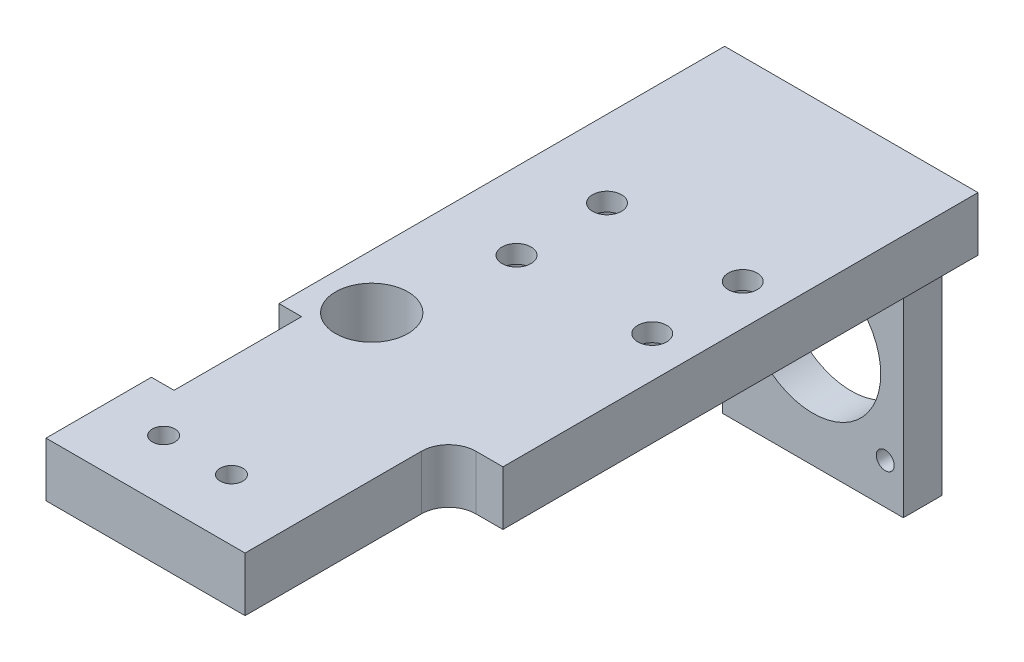
from build123d import *

# Parameters (mm, degrees)
BACK_SKETCH_R                                = 0.8
BACK_SKETCH_R_2                              = 4
BACK_SKETCH_R_3                              = 1.25
BACK_EXTRUDE_DEPTH                           = 6
BOTTOM_SKETCH_W                              = 20
BOTTOM_SKETCH_H                              = 25
BOTTOM_SKETCH_R                              = 0.989941464
BOTTOM_SKETCH_R_2                            = 7.5
BOTTOM_EXTRUDE_DEPTH                         = 4.25
CARRAIGE_MOUNT_M3S_AT_2_COUNT                = 2
CARRAIGE_MOUNT_M3S_AT_2_PITCH                = 15
CARRAIGE_MOUNT_M3S_AT_3_COUNT                = 2
CARRAIGE_MOUNT_M3S_AT_3_PITCH                = 18.027756377
CARRAIGE_MOUNT_M3S_AT_4_COUNT                = 2
CARRAIGE_MOUNT_M3S_AT_4_PITCH                = 10
ROTATIONAL_SENSOR_TAPPED_HOLES_M2_5X_2_COUNT = 2
ROTATIONAL_SENSOR_TAPPED_HOLES_M2_5X_2_PITCH = 7


with BuildPart() as part:
    # Back Sketch → Back Extrude (new body)
    with BuildSketch(Plane(origin=(0, 0, 0), x_dir=(1, 0, 0), z_dir=(0, 1, 0))):
        with BuildLine():
            Line((14, 4.25), (14, -48.25))
            Line((14, -48.25), (11, -48.25))
            ThreePointArc((11, -48.25), (8.878679656, -49.128679656), (8, -51.25))
            Line((8, -51.25), (8, -70.75))
            Line((8, -70.75), (-14, -70.75))
            Line((-14, -70.75), (-14, -59.1))
            Line((-14, -59.1), (-11.5, -59.1))
            Line((-11.5, -59.1), (-11.5, -45))
            Line((-11.5, -45), (-14, -45))
            Line((-14, -45), (-14, 4.25))
            Line((-14, 4.25), (14, 4.25))
        make_face()
        with Locations((9.5, -17.25)):
            Circle(BACK_SKETCH_R, mode=Mode.SUBTRACT)
        with Locations((-5.5, -17.25)):
            Circle(BACK_SKETCH_R, mode=Mode.SUBTRACT)
        with Locations((-5.5, -27.25)):
            Circle(BACK_SKETCH_R, mode=Mode.SUBTRACT)
        with Locations((9.5, -27.25)):
            Circle(BACK_SKETCH_R, mode=Mode.SUBTRACT)
        with Locations((-8, -40.75)):
            Circle(BACK_SKETCH_R_2, mode=Mode.SUBTRACT)
        with Locations((-7.75, -64)):
            Circle(BACK_SKETCH_R_3, mode=Mode.SUBTRACT)
        with Locations((-0.25, -64)):
            Circle(BACK_SKETCH_R_3, mode=Mode.SUBTRACT)
    extrude(amount=BACK_EXTRUDE_DEPTH)

    # Sketch1 → Carraige Mount  M3s (revolve, cut)
    with BuildSketch(Plane(origin=(9.5, 0, 27.25), x_dir=(0, 0, -1), z_dir=(1, 0, 0))):
        Polygon((0, 0), (0, 6), (1.6, 6), (1.6, 4), (3.25, 4), (3.25, 0), align=None)
    carraige_mount_m3s = revolve(axis=Axis((9.5, -6.35, 27.25), (0, 1, 0)), mode=Mode.SUBTRACT)

    # Carraige Mount  M3s at 2: Carraige Mount  M3s ×2
    with Locations(*[(-i * CARRAIGE_MOUNT_M3S_AT_2_PITCH, 0, 0) for i in range(1, CARRAIGE_MOUNT_M3S_AT_2_COUNT)]):
        add(carraige_mount_m3s, mode=Mode.SUBTRACT)

    # Carraige Mount  M3s at 3: Carraige Mount  M3s ×2
    with Locations(*[Vector(-0.8320502943378436, 0, -0.5547001962252293) * (i * CARRAIGE_MOUNT_M3S_AT_3_PITCH) for i in range(1, CARRAIGE_MOUNT_M3S_AT_3_COUNT)]):
        add(carraige_mount_m3s, mode=Mode.SUBTRACT)

    # Carraige Mount  M3s at 4: Carraige Mount  M3s ×2
    with Locations(*[(0, 0, -i * CARRAIGE_MOUNT_M3S_AT_4_PITCH) for i in range(1, CARRAIGE_MOUNT_M3S_AT_4_COUNT)]):
        add(carraige_mount_m3s, mode=Mode.SUBTRACT)

    # Sketch4 → Rotational Sensor Tapped Holes M2.5x0.45 Tapped Holes (revolve, cut)
    with BuildSketch(Plane(origin=(-11.5, 3.25, 55.25), x_dir=(0, 0, 1), z_dir=(0, 1, 0))):
        Polygon((0, 0), (0, 4.615882135), (1.025, 4), (1.025, 0), align=None)
    rotational_sensor_tapped_holes_m2_5x0_45 = revolve(axis=Axis((-17.85, 3.25, 55.25), (1, 0, 0)), mode=Mode.SUBTRACT)

    # Rotational Sensor Tapped Holes M2.5x 2: Rotational Sensor Tapped Holes M2.5x0.45 Tapped Holes ×2
    with Locations(*[(0, 0, -i * ROTATIONAL_SENSOR_TAPPED_HOLES_M2_5X_2_PITCH) for i in range(1, ROTATIONAL_SENSOR_TAPPED_HOLES_M2_5X_2_COUNT)]):
        add(rotational_sensor_tapped_holes_m2_5x0_45, mode=Mode.SUBTRACT)


with BuildPart() as body_2:
    # Bottom Sketch → Bottom Extrude (new body)
    with BuildSketch(Plane.XY):
        with Locations((0, -12.5)):
            Rectangle(BOTTOM_SKETCH_W, BOTTOM_SKETCH_H)
        with Locations((-8, -20.5)):
            Circle(BOTTOM_SKETCH_R, mode=Mode.SUBTRACT)
        with Locations((8, -20.5)):
            Circle(BOTTOM_SKETCH_R, mode=Mode.SUBTRACT)
        with Locations((-8, -4.5)):
            Circle(BOTTOM_SKETCH_R, mode=Mode.SUBTRACT)
        with Locations((0, -12.5)):
            Circle(BOTTOM_SKETCH_R_2, mode=Mode.SUBTRACT)
        with Locations((8, -4.5)):
            Circle(BOTTOM_SKETCH_R, mode=Mode.SUBTRACT)
    extrude(amount=-BOTTOM_EXTRUDE_DEPTH)


solid = Compound([part.part, body_2.part])
